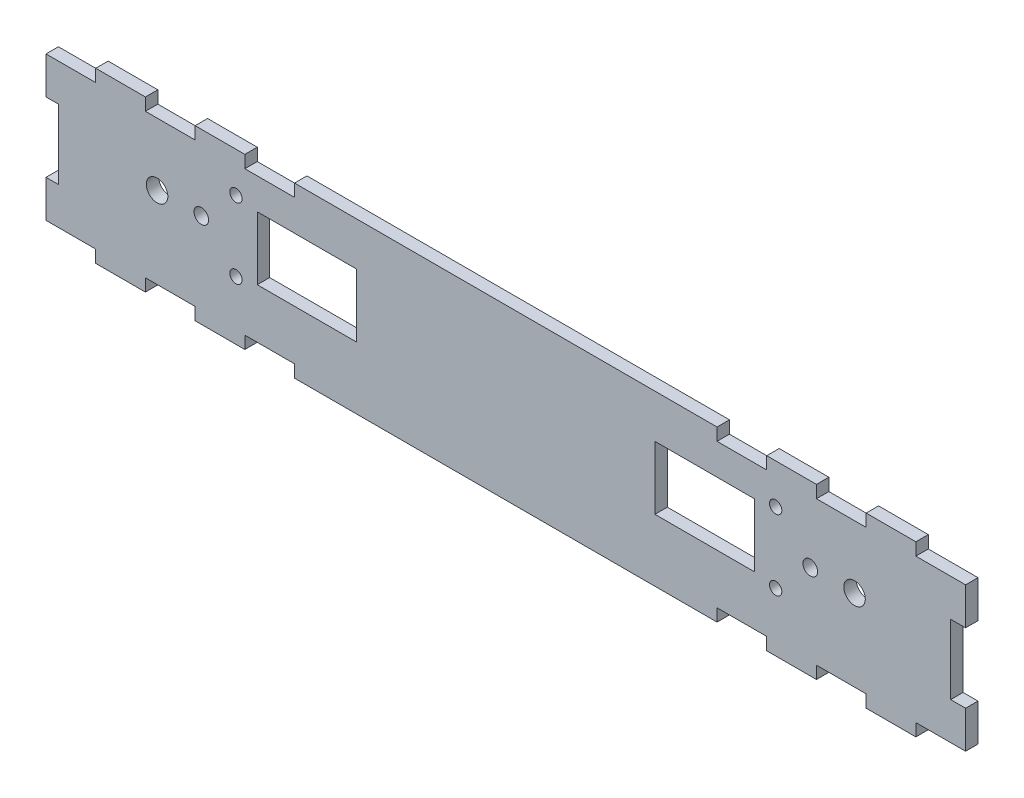
from build123d import *

# Parameters (mm, degrees)
SKETCH3_W           = 234.95
SKETCH3_H           = 30.48
SKETCH3_W_2         = 25.4
SKETCH3_H_2         = 16.15
SKETCH3_R           = 1.574999898
SKETCH3_R_2         = 1.875
SKETCH3_R_3         = 2.75
BOSS_EXTRUDE1_DEPTH = 3.175
BOSS_EXTRUDE2_DEPTH = 3.175
SKETCH5_W           = 3.175
SKETCH5_H           = 17.78
SKETCH5_W_2         = 3.81
CUT_EXTRUDE1_DEPTH  = 7.62


with BuildPart() as part:
    # Sketch3 → Boss-Extrude1 (new body)
    with BuildSketch(Plane.XY):
        with Locations((-63.5, 8.8475)):
            Rectangle(SKETCH3_W, SKETCH3_H)
        with Locations((-12.7, 11.25)):
            Rectangle(SKETCH3_W_2, SKETCH3_H_2, mode=Mode.SUBTRACT)
        with Locations((5.45, 2.250000072)):
            Circle(SKETCH3_R, mode=Mode.SUBTRACT)
        with Locations((14.3, 11.25)):
            Circle(SKETCH3_R_2, mode=Mode.SUBTRACT)
        with Locations((25.6, 11.25)):
            Circle(SKETCH3_R_3, mode=Mode.SUBTRACT)
        with Locations((5.45, 20.25)):
            Circle(SKETCH3_R, mode=Mode.SUBTRACT)
        with Locations((-114.3, 11.25)):
            Rectangle(SKETCH3_W_2, SKETCH3_H_2, mode=Mode.SUBTRACT)
        with Locations((-152.6, 11.25)):
            Circle(SKETCH3_R_3, mode=Mode.SUBTRACT)
        with Locations((-141.3, 11.25)):
            Circle(SKETCH3_R_2, mode=Mode.SUBTRACT)
        with Locations((-132.45, 20.25)):
            Circle(SKETCH3_R, mode=Mode.SUBTRACT)
        with Locations((-132.45, 2.250000072)):
            Circle(SKETCH3_R, mode=Mode.SUBTRACT)
    extrude(amount=BOSS_EXTRUDE1_DEPTH)

    # Sketch4 → Boss-Extrude2 (add)
    with BuildSketch(Plane.XY.offset(3.175)):
        Polygon((-155.575, 27.2625), (-155.575, 30.4375), (-168.275, 30.4375), (-168.275, 27.2625), (-180.975, 27.2625), (-180.975, 24.0875), (53.975, 24.0875), (53.975, 27.2625), (41.275, 27.2625), (41.275, 30.4375), (28.575, 30.4375), (28.575, 27.2625), (15.875, 27.2625), (15.875, 30.4375), (3.175, 30.4375), (3.175, 27.2625), (-9.525, 27.2625), (-9.525, 30.4375), (-117.475, 30.4375), (-117.475, 27.2625), (-130.175, 27.2625), (-130.175, 30.4375), (-142.875, 30.4375), (-142.875, 27.2625), align=None)
        Polygon((53.975, -6.3925), (-180.975, -6.3925), (-180.975, -9.5675), (-168.275, -9.5675), (-168.275, -12.7425), (-155.575, -12.7425), (-155.575, -9.5675), (-142.875, -9.5675), (-142.875, -12.7425), (-130.175, -12.7425), (-130.175, -9.5675), (-117.475, -9.5675), (-117.475, -12.7425), (-9.525, -12.7425), (-9.525, -9.5675), (3.175, -9.5675), (3.175, -12.7425), (15.875, -12.7425), (15.875, -9.5675), (28.575, -9.5675), (28.575, -12.7425), (41.275, -12.7425), (41.275, -9.5675), (53.975, -9.5675), align=None)
    extrude(amount=-BOSS_EXTRUDE2_DEPTH)

    # Sketch5 → Cut-Extrude1 (cut)
    with BuildSketch(Plane.XY.offset(3.175)):
        with Locations((-179.3875, 8.8475)):
            Rectangle(SKETCH5_W, SKETCH5_H)
        with Locations((52.07, 8.8475)):
            Rectangle(SKETCH5_W_2, SKETCH5_H)
    extrude(amount=-CUT_EXTRUDE1_DEPTH, mode=Mode.SUBTRACT)


solid = part.part
